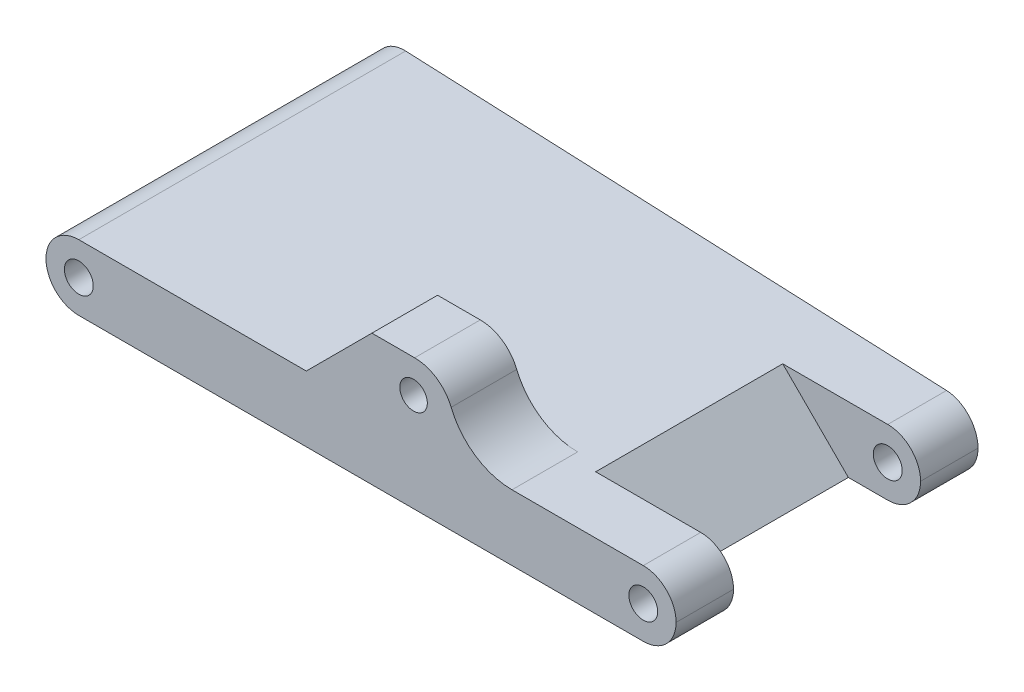
from build123d import *

# Parameters (mm, degrees)
BOSS_EXTRUDE1_DEPTH = 5
CUT_EXTRUDE1_REACH  = 39.584
SKETCH3_R           = 1.1
FILLET1_R           = 2.5
BOSS_EXTRUDE2_DEPTH = 5
SKETCH7_R           = 1.05
CUT_EXTRUDE3_DEPTH  = 5
FILLET2_R           = 5
CUT_EXTRUDE4_REACH  = 39.584
SKETCH8_W           = 5.5
SKETCH8_H           = 14.25
CHAMFER1_SIZE       = 5
FILLET3_R           = 3


with BuildPart() as part:
    # Sketch1 → Boss-Extrude1 (new body)
    with BuildSketch(Plane(origin=(0, 0, 0), x_dir=(1, 0, 0), z_dir=(0, 1, 0))):
        Polygon((-27.613970588, 0), (20.386029412, 0), (20.386029412, 23), (-27.613970588, 25), align=None)
    extrude(amount=BOSS_EXTRUDE1_DEPTH)

    # Cut-Extrude1: up to this plane
    cut_extrude1_end = Plane(origin=(-27.613970588, 5, -25), z_dir=(-0.04163054471218136, 0, 0.999133073092352))
    # Sketch3 → Cut-Extrude1 (cut, up to the surface)
    with BuildSketch(Plane.XY, mode=Mode.PRIVATE) as cut_extrude1_sk1:
        with Locations((-25.113970588, 2.5)):
            Circle(SKETCH3_R)
    cut_extrude1_tool1 = split(extrude(cut_extrude1_sk1.sketch, amount=-CUT_EXTRUDE1_REACH, mode=Mode.PRIVATE), bisect_by=cut_extrude1_end, keep=Keep.BOTH, mode=Mode.PRIVATE)
    add(cut_extrude1_tool1.solids().sort_by_distance((-25.113971, 2.5, 0))[0], mode=Mode.SUBTRACT)
    # Sketch3 → Cut-Extrude1 (cut, up to the surface)
    with BuildSketch(Plane.XY, mode=Mode.PRIVATE) as cut_extrude1_sk2:
        with Locations((17.886029412, 2.5)):
            Circle(SKETCH3_R)
    cut_extrude1_tool2 = split(extrude(cut_extrude1_sk2.sketch, amount=-CUT_EXTRUDE1_REACH, mode=Mode.PRIVATE), bisect_by=cut_extrude1_end, keep=Keep.BOTH, mode=Mode.PRIVATE)
    add(cut_extrude1_tool2.solids().sort_by_distance((17.886029, 2.5, 0))[0], mode=Mode.SUBTRACT)

    # Fillet1
    fillet1_edges = [part.edges().sort_by_distance(p)[0] for p in [
        (20.386029412, 0, -11.5),
        (20.386029412, 5, -11.5),
        (-27.613970588, 0, -12.5),
        (-27.613970588, 5, -12.5),
    ]]
    fillet(fillet1_edges, radius=FILLET1_R - 0.0001)  # a hair under: the kernel refuses the full size

    # Sketch4 → Boss-Extrude2 (add)
    with BuildSketch(Plane.XY):
        Polygon((-7.7850384, 5), (-2.7850384, 10), (2.886029412, 10), (2.886029412, 5), (-0.713970588, 5), (-4.249504494, 1.464466094), align=None)
    extrude(amount=-BOSS_EXTRUDE2_DEPTH)

    # Sketch7 → Cut-Extrude3 (cut)
    with BuildSketch(Plane.XY):
        with Locations((0.386029412, 7.492375144)):
            Circle(SKETCH7_R)
    extrude(amount=-CUT_EXTRUDE3_DEPTH, mode=Mode.SUBTRACT)

    # Fillet2
    fillet2_edges = [part.edges().sort_by_distance(p)[0] for p in [
        (2.886029412, 5, -2.5),
    ]]
    fillet(fillet2_edges, radius=FILLET2_R - 0.0001)  # a hair under: the kernel refuses the full size

    # Cut-Extrude4: up to this face of the body (flat: up to its plane)
    cut_extrude4_end = Plane(part.part.faces().sort_by_distance((-3.881478864, 0, -12.005573089))[0])
    # Sketch8 → Cut-Extrude4 (cut, up to the picked face)
    with BuildSketch(Plane(origin=(0, 5, 0), x_dir=(1, 0, 0), z_dir=(0, 1, 0)), mode=Mode.PRIVATE) as cut_extrude4_sk1:
        with Locations((17.636029412, 11.5)):
            Rectangle(SKETCH8_W, SKETCH8_H)
    cut_extrude4_tool1 = split(extrude(cut_extrude4_sk1.sketch, amount=-CUT_EXTRUDE4_REACH, mode=Mode.PRIVATE), bisect_by=cut_extrude4_end, keep=Keep.BOTH, mode=Mode.PRIVATE)
    add(cut_extrude4_tool1.solids().sort_by(Axis((17.636029, 5, -11.5), (0, -1, 0)))[0], mode=Mode.SUBTRACT)

    # Chamfer1
    chamfer1_edges = [part.edges().sort_by_distance(p)[0] for p in [
        (14.886029412, 5, -11.5),
    ]]
    chamfer(chamfer1_edges, length=CHAMFER1_SIZE - 0.0001)  # a hair under: the kernel refuses the full size

    # Fillet3
    fillet3_edges = [part.edges().sort_by_distance(p)[0] for p in [
        (2.886029412, 10, -2.5),
    ]]
    fillet(fillet3_edges, radius=FILLET3_R)


solid = part.part
